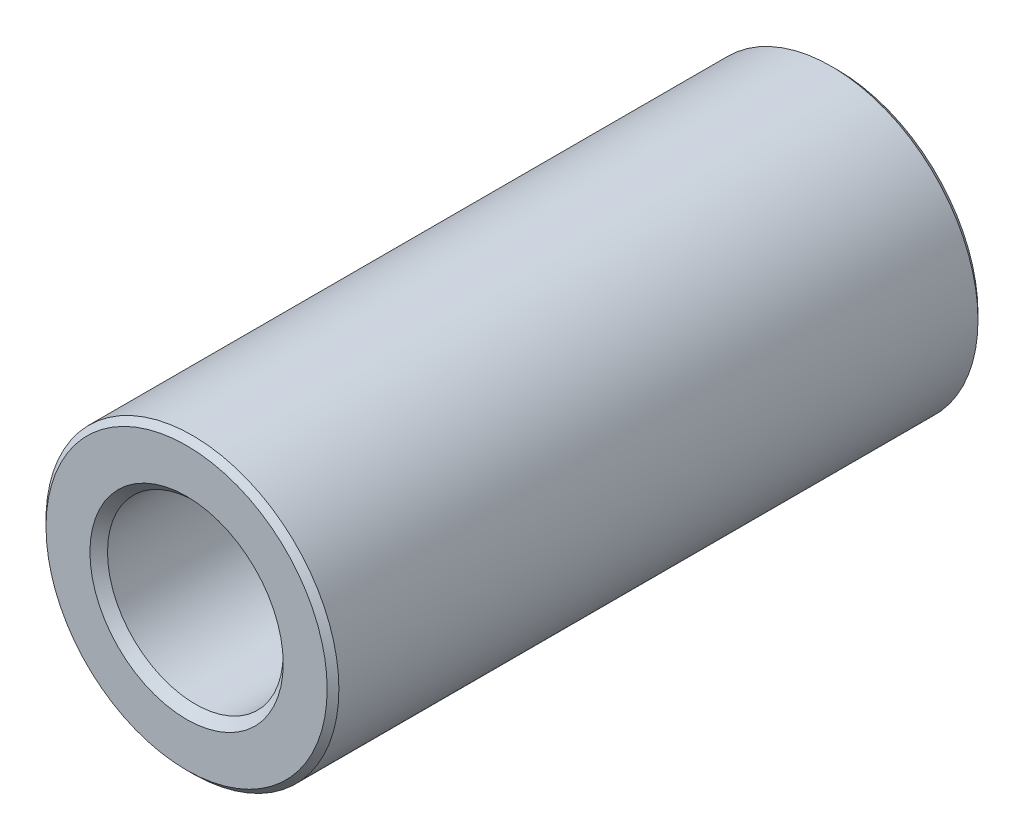
from build123d import *

# Parameters (mm, degrees)
BOSS_EXTRUDE1_DEPTH      = 5
BOSS_EXTRUDE1_DEPTH_BACK = 5
SKETCH3_R                = 2.25
SKETCH3_R_2              = 1.35
CHAMFER1_SIZE            = 0.09
CHAMFER2_SIZE            = 0.135


with BuildPart() as part:
    # Sketch3 → Boss-Extrude1 (new, two sides: drawn at the far end of the back side and taken through both)
    with BuildSketch(Plane.XY.offset(-BOSS_EXTRUDE1_DEPTH_BACK)):
        Circle(SKETCH3_R)
        Circle(SKETCH3_R_2, mode=Mode.SUBTRACT)
    extrude(amount=BOSS_EXTRUDE1_DEPTH + BOSS_EXTRUDE1_DEPTH_BACK)

    # Chamfer1
    chamfer1_edges = [part.edges().sort_by_distance(p)[0] for p in [
        (-2.25, 0, -5),
        (-2.25, 0, 5),
    ]]
    chamfer(chamfer1_edges, length=CHAMFER1_SIZE)

    # Chamfer2
    chamfer2_edges = [part.edges().sort_by_distance(p)[0] for p in [
        (-1.35, 0, -5),
        (-1.35, 0, 5),
    ]]
    chamfer(chamfer2_edges, length=CHAMFER2_SIZE)


solid = part.part
